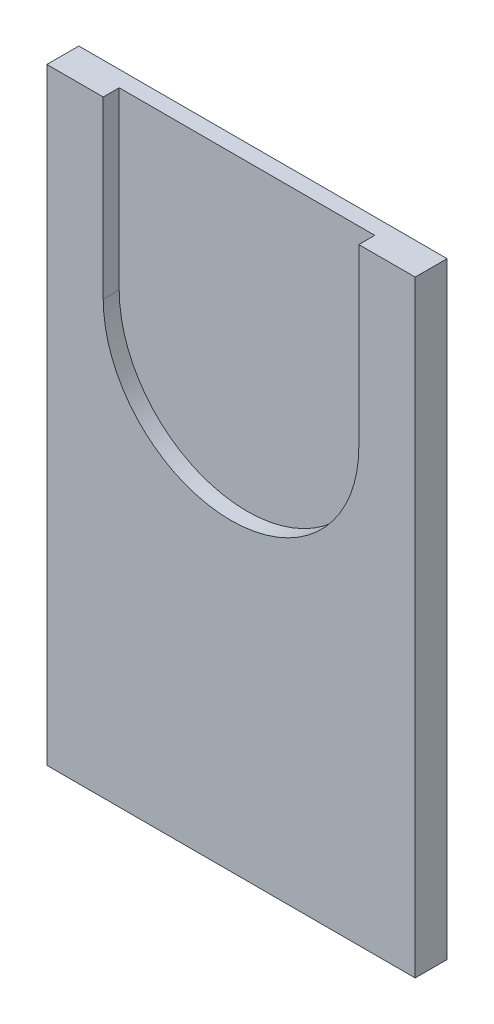
from build123d import *

# Parameters (mm, degrees)
SKETCH_1_W          = 57.64
SKETCH_1_H          = 125
EXTRUDE_1_DEPTH     = 5
CUT_EXTRUDE_1_DEPTH = 2.5
SKETCH_3_W          = 57.64
SKETCH_3_H          = 30
CUT_EXTRUDE_2_DEPTH = 10


with BuildPart() as part:
    # 스케치1 → 보스-돌출1 (new body)
    with BuildSketch(Plane.XY):
        Rectangle(SKETCH_1_W, SKETCH_1_H)
    extrude(amount=EXTRUDE_1_DEPTH)

    # 스케치2 → 컷-돌출1 (cut)
    with BuildSketch(Plane.XY.offset(5)):
        with BuildLine():
            Line((20, 5.10170356), (20, 62.5))
            Line((20, 62.5), (-20, 62.5))
            Line((-20, 62.5), (-20, 5.10170356))
            ThreePointArc((-20, 5.10170356), (0, -14.89829644), (20, 5.10170356))
        make_face()
    extrude(amount=-CUT_EXTRUDE_1_DEPTH, mode=Mode.SUBTRACT)

    # 스케치3 → 컷-돌출2 (cut)
    with BuildSketch(Plane.XY.offset(5)):
        with Locations((0, 47.5)):
            Rectangle(SKETCH_3_W, SKETCH_3_H)
    extrude(amount=-CUT_EXTRUDE_2_DEPTH, mode=Mode.SUBTRACT)


solid = part.part
